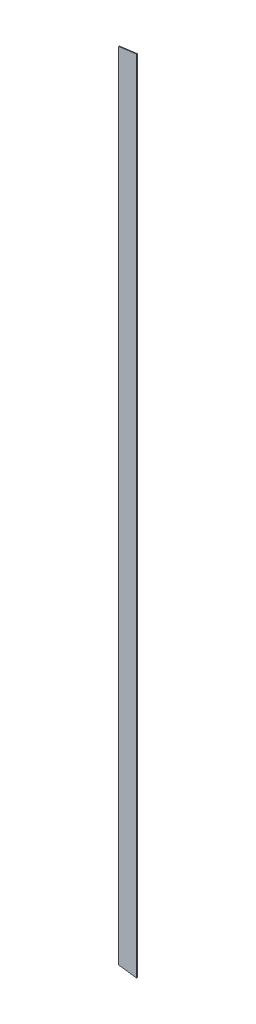
from build123d import *

# Parameters (mm, degrees)
SKETCH_1_W          = 50
SKETCH_1_H          = 2300
EXTRUDE_1_DEPTH     = 1
CUT_EXTRUDE_START   = -2
CUT_EXTRUDE_1_DEPTH = 2


# Read off the part's stored shape, not the designer's step: Вырез-Вытянуть1
with BuildPart() as part:
    # Эскиз1 → Бобышка-Вытянуть1 (new, symmetric)
    with BuildSketch(Plane.XY):
        Rectangle(SKETCH_1_W, SKETCH_1_H)
    extrude(amount=EXTRUDE_1_DEPTH, both=True)

    # Вырез-Вытянуть1 outline → Вырез-Вытянуть1 (cut)
    with BuildSketch(Plane.XY.offset(1).offset(CUT_EXTRUDE_START)):
        Polygon((25, -1120), (-25, -1113.577586207), (-25, -1150), (25, -1150), align=None)
        Polygon((-25, 1150), (-25, 1113.577586207), (25, 1120), (25, 1150), align=None)
    extrude(amount=CUT_EXTRUDE_1_DEPTH, mode=Mode.SUBTRACT)


solid = part.part
